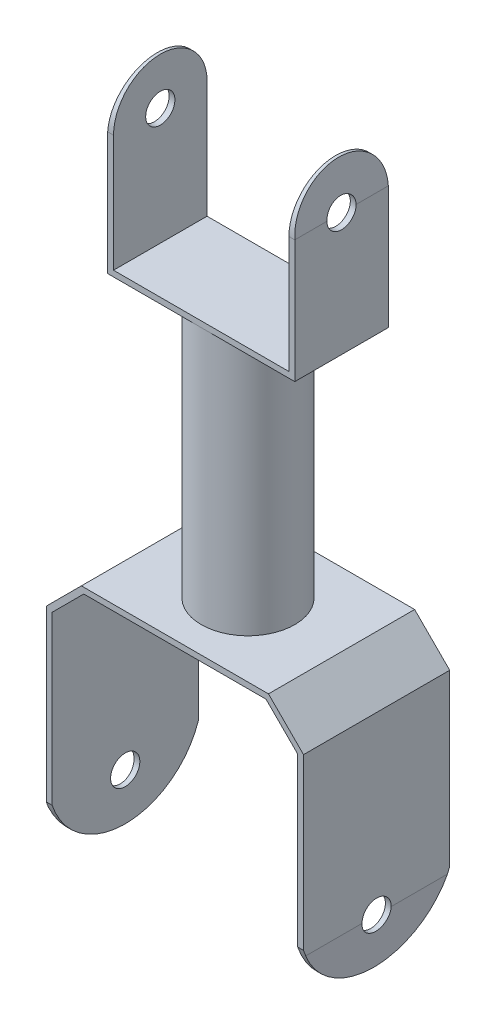
from build123d import *

# Parameters (mm, degrees)
BOSS_EXTRUDE1_DEPTH     = 12.5
BOSS_EXTRUDE1_2_DEPTH   = 12.5
CUT_EXTRUDE1_DEPTH      = 119.208502232
CUT_EXTRUDE1_DEPTH_BACK = 119.208502232
SKETCH3_R               = 2.5
SKETCH4_R               = 8
SKETCH4_R_2             = 6.000365116
BOSS_EXTRUDE2_DEPTH     = 44


with BuildPart() as part:
    # Sketch1 → Boss-Extrude1 (new, symmetric)
    with BuildSketch(Plane.XY):
        Polygon((-16, 101), (-16, 80), (16, 80), (16, 101), (15.5, 109), (15, 109), (15, 101), (15, 81), (-15, 81), (-15, 101), (-15, 109), (-15.5, 109), align=None)
    extrude(amount=BOSS_EXTRUDE1_DEPTH, both=True)


with BuildPart() as body_2:
    # Sketch1 → Boss-Extrude1 2 (new, symmetric)
    with BuildSketch(Plane.XY):
        Polygon((-22, 0), (-22, 30), (-16, 36), (16, 36), (22, 30), (22, 0), (21.5, -8), (21, -8), (21, 0), (21, 29.585786438), (15.585786438, 35), (-15.585786438, 35), (-21, 29.585786438), (-21, 0), (-21, -8), (-21.5, -8), align=None)
    extrude(amount=BOSS_EXTRUDE1_2_DEPTH, both=True)


with BuildPart() as cut_extrude1_tool:
    # Sketch3 → Cut-Extrude1 (new, two sides: drawn at the far end of the back side and taken through both)
    with BuildSketch(Plane(origin=(22, 0, 0), x_dir=(0, 0, -1), z_dir=(1, 0, 0)).offset(-CUT_EXTRUDE1_DEPTH_BACK)):
        Circle(SKETCH3_R)
        with Locations((0, 101)):
            Circle(SKETCH3_R)
        with BuildLine():
            Line((-8, 80), (-12.5, 80))
            Line((-12.5, 80), (-12.5, 110.5))
            Line((-12.5, 110.5), (12.5, 110.5))
            Line((12.5, 110.5), (12.5, 80))
            Line((12.5, 80), (8, 80))
            Line((8, 80), (8, 101))
            ThreePointArc((8, 101), (0, 109), (-8, 101))
            Line((-8, 101), (-8, 80))
        make_face()
        with BuildLine():
            Line((-12.5, 36), (-17.5, 36))
            Line((-17.5, 36), (-17.5, -14.418758351))
            Line((-17.5, -14.418758351), (17.5, -14.418758351))
            Line((17.5, -14.418758351), (17.5, 36))
            Line((17.5, 36), (12.5, 36))
            Line((12.5, 36), (12.5, 1))
            ThreePointArc((12.5, 1), (0, -8.00776969), (-12.5, 1))
            Line((-12.5, 1), (-12.5, 36))
        make_face()
    extrude(amount=CUT_EXTRUDE1_DEPTH + CUT_EXTRUDE1_DEPTH_BACK)


with BuildPart() as part_1:
    add(part.part)

    # Cut-Extrude1: cut by cut_extrude1_tool
    add(cut_extrude1_tool.part, mode=Mode.SUBTRACT)



with BuildPart() as body_2_1:
    add(body_2.part)

    # Cut-Extrude1: cut by cut_extrude1_tool
    add(cut_extrude1_tool.part, mode=Mode.SUBTRACT)


with BuildPart() as part_2:
    add(part_1.part)

    add(body_2_1.part)  # Boss-Extrude2 merges body 2
    # Sketch4 → Boss-Extrude2 (add)
    with BuildSketch(Plane(origin=(0, 36, 0), x_dir=(1, 0, 0), z_dir=(0, 1, 0))):
        Circle(SKETCH4_R)
        Circle(SKETCH4_R_2, mode=Mode.SUBTRACT)
    extrude(amount=BOSS_EXTRUDE2_DEPTH)


solid = part_2.part
